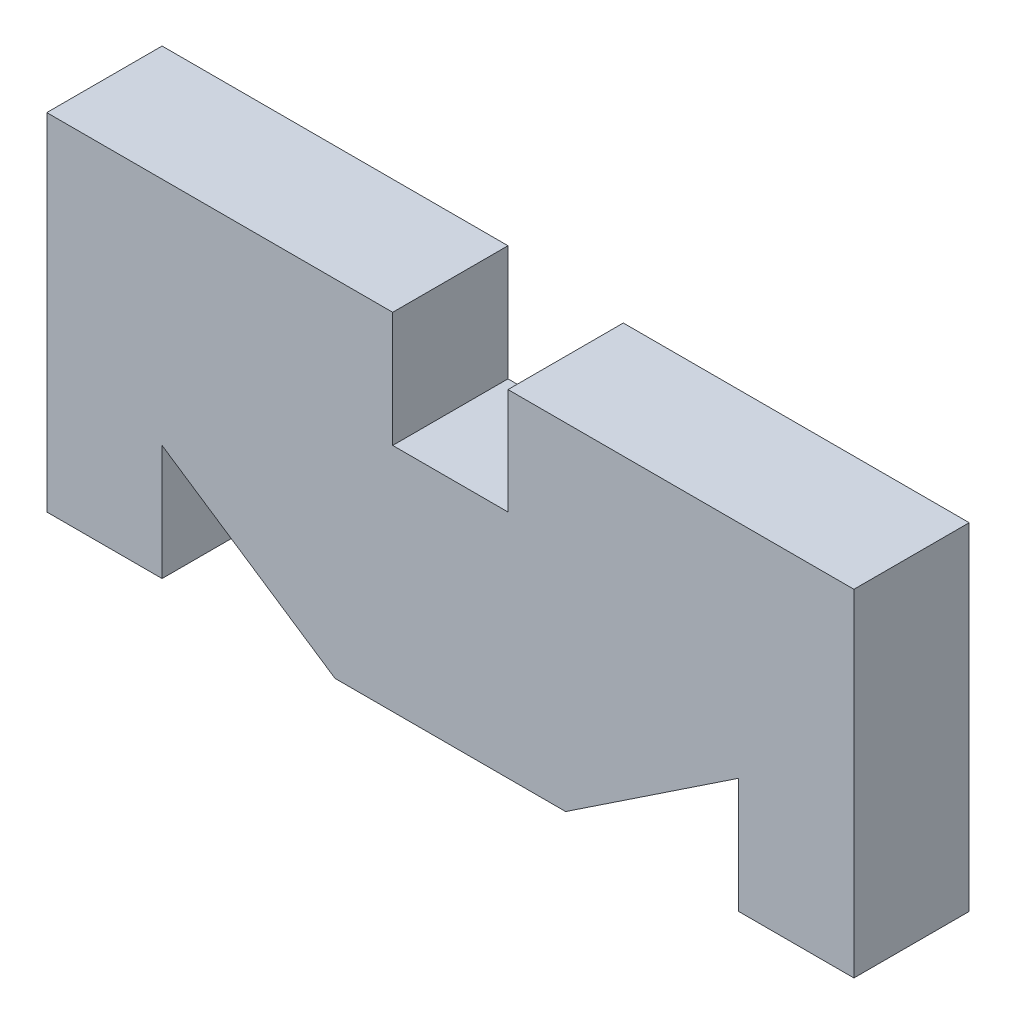
from build123d import *

# Parameters (mm, degrees)
BOSS_EXTRUDE1_DEPTH = 10


with BuildPart() as part:
    # Sketch1 → Boss-Extrude1 (new body)
    with BuildSketch(Plane.XY):
        Polygon((-21.964285714, 0), (-21.964285714, 30), (8.035714286, 30), (8.035714286, 20), (18.035714286, 20), (18.035714286, 29.196428571), (48.035714286, 29.196428571), (48.035714286, 0), (38.035714286, 0), (38.035714286, 10), (23.035714286, 0), (3.035714286, 0), (-11.964285714, 10), (-11.964285714, 0), align=None)
    extrude(amount=BOSS_EXTRUDE1_DEPTH)


solid = part.part
